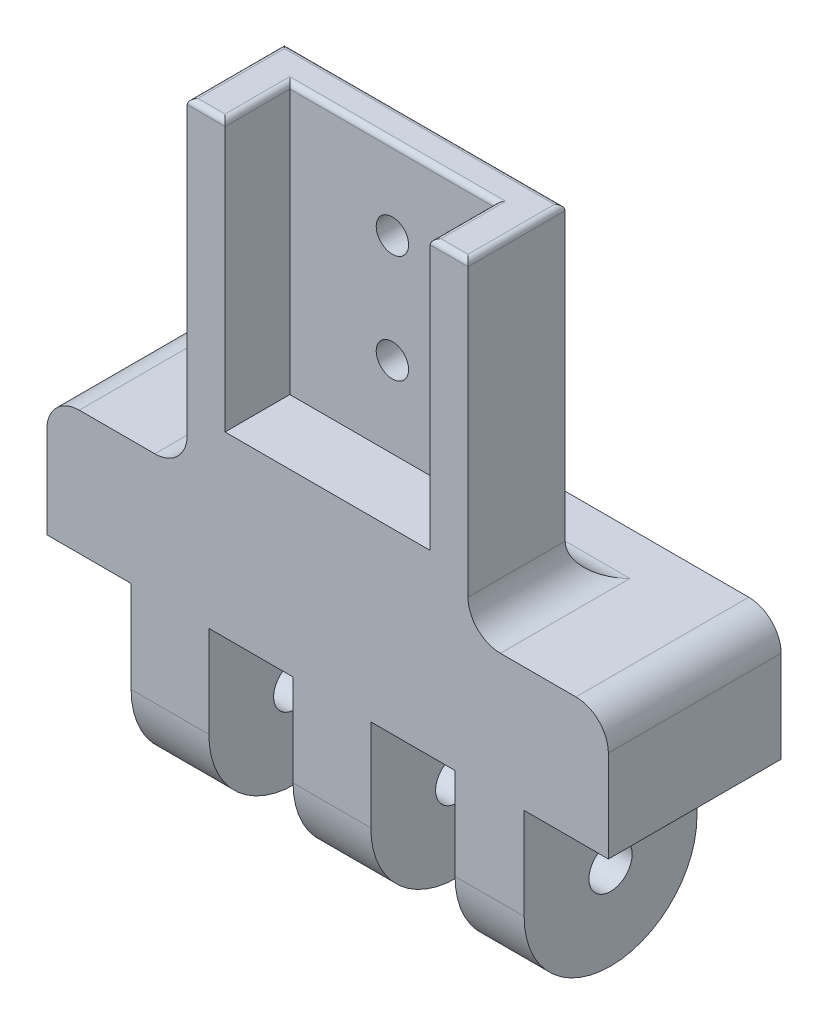
from build123d import *

# Parameters (mm, degrees)
SKETCH2_R           = 2
BOSS_EXTRUDE1_DEPTH = 26
SKETCH3_W           = 7.8
SKETCH3_H           = 17
CUT_EXTRUDE1_DEPTH  = 37.496575182
SKETCH5_W           = 26
SKETCH5_H           = 9
BOSS_EXTRUDE2_DEPTH = 30
SKETCH6_W           = 19
SKETCH6_H           = 6
CUT_EXTRUDE2_DEPTH  = 25
SKETCH7_R           = 1.5
CUT_EXTRUDE3_DEPTH  = 12.5
FILLET2_R           = 3
FILLET3_R           = 3
FILLET4_R           = 0.5


with BuildPart() as part:
    # Sketch2 → Boss-Extrude1 (new, symmetric)
    with BuildSketch(Plane(origin=(0, 0, 0), x_dir=(0, 0, -1), z_dir=(1, 0, 0))):
        with BuildLine():
            Line((-8, 0), (-8, 20))
            Line((-8, 20), (8, 20))
            Line((8, 20), (8, 0))
            ThreePointArc((8, 0), (0, -8), (-8, 0))
        make_face()
        Circle(SKETCH2_R, mode=Mode.SUBTRACT)
    extrude(amount=BOSS_EXTRUDE1_DEPTH, both=True)

    # Sketch3 → Cut-Extrude1 (cut, through all)
    with BuildSketch(Plane.XY.offset(8)):
        with Locations((-22.1, 0)):
            Rectangle(SKETCH3_W, SKETCH3_H)
        with Locations((-7.1, 0)):
            Rectangle(SKETCH3_W, SKETCH3_H)
        with Locations((7.9, 0)):
            Rectangle(SKETCH3_W, SKETCH3_H)
        with Locations((22.1, 0)):
            Rectangle(SKETCH3_W, SKETCH3_H)
    extrude(amount=-CUT_EXTRUDE1_DEPTH, mode=Mode.SUBTRACT)

    # Sketch5 → Boss-Extrude2 (add)
    with BuildSketch(Plane(origin=(0, 20, 0), x_dir=(1, 0, 0), z_dir=(0, 1, 0))):
        with Locations((0, -3.5)):
            Rectangle(SKETCH5_W, SKETCH5_H)
    extrude(amount=BOSS_EXTRUDE2_DEPTH)

    # Sketch6 → Cut-Extrude2 (cut)
    with BuildSketch(Plane(origin=(0, 50, 0), x_dir=(1, 0, 0), z_dir=(0, 1, 0))):
        with Locations((0, -5)):
            Rectangle(SKETCH6_W, SKETCH6_H)
    extrude(amount=-CUT_EXTRUDE2_DEPTH, mode=Mode.SUBTRACT)

    # Sketch7 → Cut-Extrude3 (cut, symmetric)
    with BuildSketch(Plane.XY):
        with Locations((0, 42.5)):
            Circle(SKETCH7_R)
        with Locations((0, 32.5)):
            Circle(SKETCH7_R)
    extrude(amount=CUT_EXTRUDE3_DEPTH, both=True, mode=Mode.SUBTRACT)

    # Fillet2
    fillet2_edges = [part.edges().sort_by_distance(p)[0] for p in [
        (13, 20, 3.5),
        (0, 20, -1),
        (-13, 20, 3.5),
    ]]
    fillet(fillet2_edges, radius=FILLET2_R)

    # Fillet3
    fillet3_edges = [part.edges().sort_by_distance(p)[0] for p in [
        (-26, 20, 0),
        (26, 20, 0),
    ]]
    fillet(fillet3_edges, radius=FILLET3_R)

    # Fillet4
    fillet4_edges = [part.edges().sort_by_distance(p)[0] for p in [
        (11.25, 50, 8),
        (13, 50, 3.5),
        (9.5, 50, 5),
        (-11.25, 50, 8),
        (-9.5, 50, 5),
        (0, 50, 2),
        (-13, 50, 3.5),
        (0, 50, -1),
    ]]
    fillet(fillet4_edges, radius=FILLET4_R)


solid = part.part
